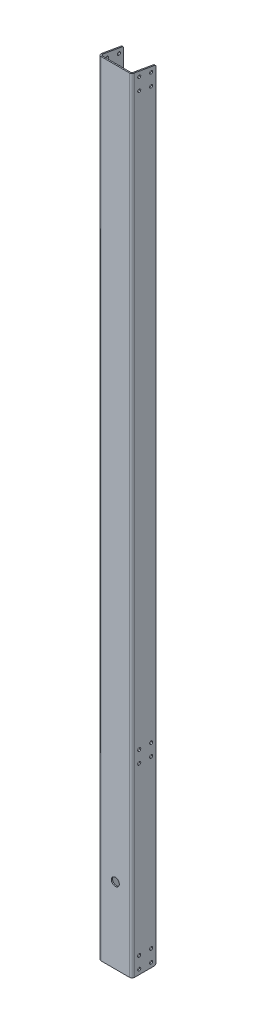
from build123d import *

# Parameters (mm, degrees)
SKETCH1_W                    = 53.35524
SKETCH1_H                    = 1249.934
BASE_FLANGE1_DEPTH           = 1.89738
EDGE_FLANGE1_STRIP_W         = 11.65352
EDGE_FLANGE1_STRIP_H         = 1.89738
EDGE_FLANGE1_STRIP_CUT_DEPTH = 1249.934
EDGE_FLANGE1_DEPTH           = 1249.934
EDGE_FLANGE1_FLAT_DEPTH      = 1.89738
EDGE_FLANGE2_STRIP_W         = 11.65352
EDGE_FLANGE2_STRIP_H         = 1.89738
EDGE_FLANGE2_STRIP_CUT_DEPTH = 1249.934
EDGE_FLANGE2_DEPTH           = 1249.934
EDGE_FLANGE2_FLAT_DEPTH      = 1.89738
FILLET1_R                    = 2.54
SKETCH12_R                   = 2.4638
CUT_EXTRUDE1_DEPTH           = 629.39648529
SKETCH13_R                   = 2.4638
CUT_EXTRUDE2_DEPTH           = 629.39648529
SKETCH14_R                   = 2.4638
CUT_EXTRUDE3_DEPTH           = 629.39648529
F_1_2_0_5_DIAMETER_HOLE1_D   = 12.7


# Sheet-metal steps are written as plain solids
with BuildPart() as part:
    # Sketch1 → Base-Flange1 (new body)
    with BuildSketch(Plane.XY):
        Rectangle(SKETCH1_W, SKETCH1_H)
    extrude(amount=-BASE_FLANGE1_DEPTH)

    # Edge-Flange1 strip (across the edge) → Edge-Flange1 strip cut (cut)
    with BuildSketch(Plane(origin=(26.67762, 624.967, -1.89738), x_dir=(-1, 0, 0), z_dir=(0, -1, 0))):
        with Locations((-1.89738, -0.94869)):
            Rectangle(EDGE_FLANGE1_STRIP_W, EDGE_FLANGE1_STRIP_H)
    extrude(amount=EDGE_FLANGE1_STRIP_CUT_DEPTH, mode=Mode.SUBTRACT)

    # Edge-Flange1 bend section (across the edge) → Edge-Flange1 (add)
    with BuildSketch(Plane(origin=(26.67762, 624.967, -1.89738), x_dir=(-1, 0, 0), z_dir=(0, -1, 0))):
        with BuildLine():
            Line((0, 2.032), (1.89738, 2.032))
            ThreePointArc((1.89738, 2.032), (2.492539021, 0.595159021), (3.92938, 0))
            Line((3.92938, 0), (3.92938, -1.89738))
            ThreePointArc((3.92938, -1.89738), (1.150888756, -0.746491244), (0, 2.032))
        make_face()
    extrude(amount=EDGE_FLANGE1_DEPTH)

    # Edge-Flange1 profile (on flange) → Edge-Flange1 flat (add)
    with BuildSketch(Plane(origin=(26.67762, 0, -1.89738), x_dir=(0, 1, 0), z_dir=(-1, 0, 0))):
        Polygon((624.967, 2.032), (624.967, 2.87782), (619.090938633, 36.20262), (-624.967, 36.20262), (-624.967, 2.032), align=None)
    extrude(amount=EDGE_FLANGE1_FLAT_DEPTH)

    # Edge-Flange2 strip (across the edge) → Edge-Flange2 strip cut (cut)
    with BuildSketch(Plane(origin=(-26.67762, -624.967, -1.89738), x_dir=(1, 0, 0), z_dir=(0, 1, 0))):
        with Locations((-1.89738, -0.94869)):
            Rectangle(EDGE_FLANGE2_STRIP_W, EDGE_FLANGE2_STRIP_H)
    extrude(amount=EDGE_FLANGE2_STRIP_CUT_DEPTH, mode=Mode.SUBTRACT)

    # Edge-Flange2 bend section (across the edge) → Edge-Flange2 (add)
    with BuildSketch(Plane(origin=(-26.67762, -624.967, -1.89738), x_dir=(1, 0, 0), z_dir=(0, 1, 0))):
        with BuildLine():
            Line((0, 2.032), (1.89738, 2.032))
            ThreePointArc((1.89738, 2.032), (2.492539021, 0.595159021), (3.92938, 0))
            Line((3.92938, 0), (3.92938, -1.89738))
            ThreePointArc((3.92938, -1.89738), (1.150888756, -0.746491244), (0, 2.032))
        make_face()
    extrude(amount=EDGE_FLANGE2_DEPTH)

    # Edge-Flange2 profile (on flange) → Edge-Flange2 flat (add)
    with BuildSketch(Plane(origin=(-26.67762, 0, -1.89738), x_dir=(0, -1, 0), z_dir=(1, 0, 0))):
        Polygon((-624.967, 2.87782), (-624.967, 2.032), (624.967, 2.032), (624.967, 36.20262), (-619.090938633, 36.20262), align=None)
    extrude(amount=EDGE_FLANGE2_FLAT_DEPTH)

    # Fillet1
    fillet1_edges = [part.edges().sort_by_distance(p)[0] for p in [
        (25.72893, -624.967, -38.1),
        (25.72893, 619.090938633, -38.1),
        (-25.72893, -624.967, -38.1),
        (-25.72893, 619.090938633, -38.1),
    ]]
    fillet(fillet1_edges, radius=FILLET1_R)

    # Sketch12 → Cut-Extrude1 (cut, through all)
    with BuildSketch(Plane.ZY.offset(26.67762)):
        with Locations((-30.48, -617.347)):
            Circle(SKETCH12_R)
        with Locations((-30.48, -598.297)):
            Circle(SKETCH12_R)
        with Locations((-11.43, -598.297)):
            Circle(SKETCH12_R)
        with Locations((-11.43, -617.347)):
            Circle(SKETCH12_R)
    extrude(amount=-CUT_EXTRUDE1_DEPTH, mode=Mode.SUBTRACT)

    # Sketch13 → Cut-Extrude2 (cut, through all)
    with BuildSketch(Plane.ZY.offset(26.67762)):
        with Locations((-30.48, 612.696999444)):
            Circle(SKETCH13_R)
        with Locations((-11.43, 616.056028426)):
            Circle(SKETCH13_R)
        with Locations((-11.43, 596.71215147)):
            Circle(SKETCH13_R)
        with Locations((-30.48, 593.353122487)):
            Circle(SKETCH13_R)
    extrude(amount=-CUT_EXTRUDE2_DEPTH, mode=Mode.SUBTRACT)

    # Sketch14 → Cut-Extrude3 (cut, through all)
    with BuildSketch(Plane(origin=(26.67762, 0, 0), x_dir=(0, 0, -1), z_dir=(1, 0, 0))):
        with Locations((11.43, -313.817)):
            Circle(SKETCH14_R)
        with Locations((11.43, -332.867)):
            Circle(SKETCH14_R)
        with Locations((30.48, -332.867)):
            Circle(SKETCH14_R)
        with Locations((30.48, -313.817)):
            Circle(SKETCH14_R)
    extrude(amount=-CUT_EXTRUDE3_DEPTH, mode=Mode.SUBTRACT)

    # 1/2 (0.5) Diameter Hole1 (through all)
    with Locations(Plane.XY):
        with Locations((0, -504.317)):
            Hole(F_1_2_0_5_DIAMETER_HOLE1_D / 2)


solid = part.part
